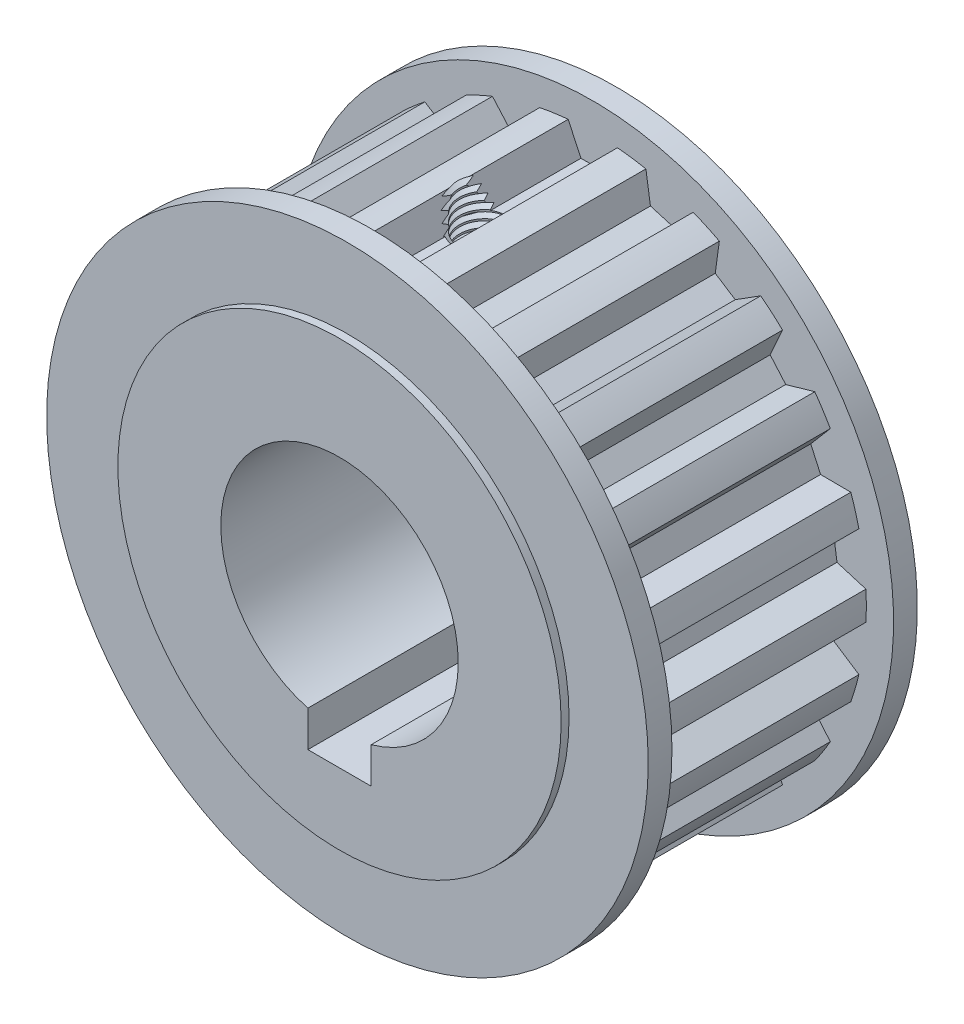
from build123d import *

# Parameters (mm, degrees)
SKETCH1_R           = 17.275
SKETCH1_R_2         = 7.5
BOSS_EXTRUDE1_DEPTH = 18
CUT_EXTRUDE1_DEPTH  = 18
CIRPATTERN1_COUNT   = 22
CUT_EXTRUDE2_START  = -2
SKETCH3_R           = 17.275
SKETCH3_R_2         = 14
CUT_EXTRUDE2_DEPTH  = 2
SKETCH4_R           = 17.275
SKETCH4_R_2         = 14
CUT_EXTRUDE3_DEPTH  = 2
SKETCH5_R           = 1.5
CUT_EXTRUDE4_DEPTH  = 18
CUT_SWEEP1_PITCH    = 0.5
BOSS_EXTRUDE2_START = 1.5
SKETCH8_R           = 19
SKETCH8_R_2         = 14
BOSS_EXTRUDE2_DEPTH = 1.5
SKETCH9_R           = 19
SKETCH9_R_2         = 14
BOSS_EXTRUDE3_DEPTH = 1.5
SKETCH10_W          = 4
SKETCH10_H          = 4
CUT_EXTRUDE5_DEPTH  = 33.341923313


with BuildPart() as part:
    # Sketch1 → Boss-Extrude1 (new body)
    with BuildSketch(Plane.XY):
        Circle(SKETCH1_R)
        Circle(SKETCH1_R_2, mode=Mode.SUBTRACT)
    extrude(amount=BOSS_EXTRUDE1_DEPTH)

    # Sketch2 → Cut-Extrude1 (cut)
    with BuildSketch(Plane.XY.offset(18)):
        Polygon((-0.75, 15.475), (0.75, 15.475), (1.7560414, 17.632462745), (-1.7560414, 17.632462745), align=None)
    cut_extrude1 = extrude(amount=-CUT_EXTRUDE1_DEPTH, mode=Mode.SUBTRACT)

    # CirPattern1: Cut-Extrude1 ×22 about axis
    cirpattern1_axis = Axis((0, 0, 0), (0, 0, 1))
    for i in range(1, CIRPATTERN1_COUNT):
        add(cut_extrude1.rotate(cirpattern1_axis, i * 360 / CIRPATTERN1_COUNT), mode=Mode.SUBTRACT)

    # Sketch3 → Cut-Extrude2 (cut)
    with BuildSketch(Plane.XY.offset(18).offset(CUT_EXTRUDE2_START)):
        Circle(SKETCH3_R)
        Circle(SKETCH3_R_2, mode=Mode.SUBTRACT)
    extrude(amount=CUT_EXTRUDE2_DEPTH, mode=Mode.SUBTRACT)

    # Sketch4 → Cut-Extrude3 (cut)
    with BuildSketch(Plane(origin=(0, 0, 0), x_dir=(-1, 0, 0), z_dir=(0, 0, -1))):
        Circle(SKETCH4_R)
        with Locations(Location((0, 0, 0), (0, 0, 180))):
            Circle(SKETCH4_R_2, mode=Mode.SUBTRACT)
    extrude(amount=-CUT_EXTRUDE3_DEPTH, mode=Mode.SUBTRACT)

    # Sketch5 → Cut-Extrude4 (cut)
    with BuildSketch(Plane(origin=(0, 0, 0), x_dir=(1, 0, 0), z_dir=(0, 1, 0))):
        with Locations(Location((0, -9, 0), (0, 0, 90))):
            Circle(SKETCH5_R)
    extrude(amount=CUT_EXTRUDE4_DEPTH, mode=Mode.SUBTRACT)

    # Cut-Sweep1: arcs per turn and ends read off the stored shape
    # Cut-Sweep1: the profile of Sketch7 screwed along a left-hand helix through 41 turns, 6 arcs to a turn; built about Z, then put on its axis
    cut_sweep1_z = Axis((0, 0, 0), (0, 0, 1))
    cut_sweep1_corners = [(1.828380933, 0, -0.513464933), (1.303380933, 0, -0.816573825), (1.303380933, 0, -0.210356042)]
    with BuildLine(mode=Mode.PRIVATE) as cut_sweep1_profile:
        Line(cut_sweep1_corners[0], cut_sweep1_corners[1])
        Line(cut_sweep1_corners[1], cut_sweep1_corners[2])
        Line(cut_sweep1_corners[2], cut_sweep1_corners[0])
    cut_sweep1_cap = Face(cut_sweep1_profile.wire())
    cut_sweep1_turn_angles = [0, -30, -60, -90, -120, -150, -180, -210, -240, -270, -300, -330, -360]
    cut_sweep1_turn_weights = [1, 0.8660254037844387, 1, 0.8660254037844387, 1, 0.8660254037844387, 1, 0.8660254037844387, 1, 0.8660254037844387, 1, 0.8660254037844387, 1]
    cut_sweep1_turn_rails = [Edge.make_bspline([Vector(p[0], p[1], 0).rotate(cut_sweep1_z, cut_sweep1_turn_angles[k]) / cut_sweep1_turn_weights[k] + Vector(0, 0, p[2] + -CUT_SWEEP1_PITCH * cut_sweep1_turn_angles[k] / 360) for k in range(13)], [0, 0, 0, 1, 1, 2, 2, 3, 3, 4, 4, 5, 5, 6, 6, 6], 2, cut_sweep1_turn_weights) for p in cut_sweep1_corners]
    cut_sweep1_turn_sides = [Face.make_surface_from_curves(cut_sweep1_turn_rails[p[0]], cut_sweep1_turn_rails[p[1]]) for p in [(0, 1), (1, 2), (2, 0)]]
    cut_sweep1 = Plane(origin=(0, 0, 9), x_dir=(0, 0, 1), z_dir=(0, 1, 0)) * Solid(Shell([*[p.moved(Location((0, 0, CUT_SWEEP1_PITCH * i))) for i in range(41) for p in cut_sweep1_turn_sides], cut_sweep1_cap, cut_sweep1_cap.rotate(cut_sweep1_z, -14760).moved(Location((0, 0, -CUT_SWEEP1_PITCH * -14760 / 360)))]))
    add(cut_sweep1, mode=Mode.SUBTRACT)

    # Sketch8 → Boss-Extrude2 (add)
    with BuildSketch(Plane(origin=(0, 0, 2), x_dir=(-1, 0, 0), z_dir=(0, 0, -1)).offset(BOSS_EXTRUDE2_START)):
        Circle(SKETCH8_R)
        with Locations(Location((0, 0, 0), (0, 0, 180))):
            Circle(SKETCH8_R_2, mode=Mode.SUBTRACT)
    extrude(amount=-BOSS_EXTRUDE2_DEPTH)

    # Sketch9 → Boss-Extrude3 (add)
    with BuildSketch(Plane.XY.offset(16)):
        with Locations(Location((0, 0, 0), (0, 0, 180))):
            Circle(SKETCH9_R)
        Circle(SKETCH9_R_2, mode=Mode.SUBTRACT)
    extrude(amount=BOSS_EXTRUDE3_DEPTH)

    # Sketch10 → Cut-Extrude5 (cut, through all)
    with BuildSketch(Plane.XY.offset(18)):
        with Locations((0, -7.5)):
            Rectangle(SKETCH10_W, SKETCH10_H)
    extrude(amount=-CUT_EXTRUDE5_DEPTH, mode=Mode.SUBTRACT)


solid = part.part
